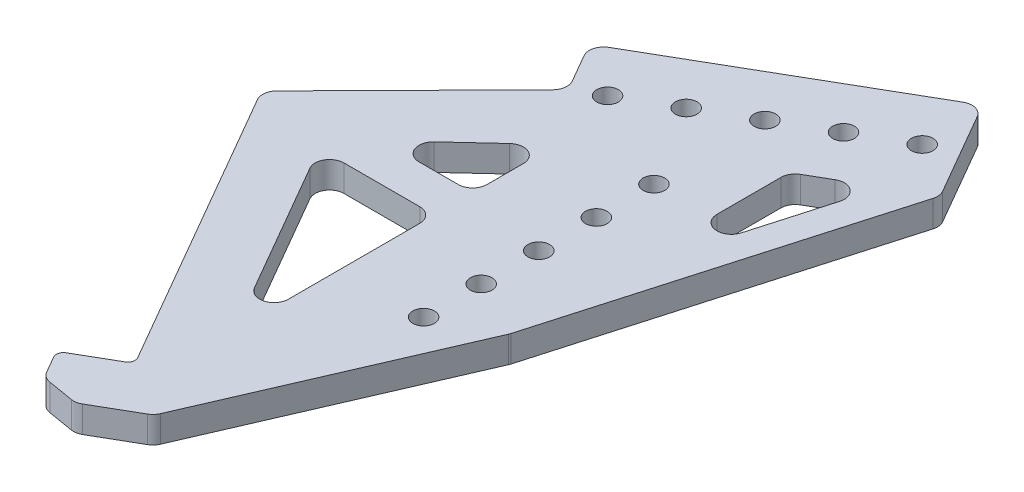
from build123d import *

# Parameters (mm, degrees)
SKETCH1_R           = 2.38125
BOSS_EXTRUDE1_DEPTH = 5.842
FILLET1_R           = 3.175
FILLET2_R           = 3.175
FILLET3_R           = 1.5875
FILLET5_R           = 3.175


with BuildPart() as part:
    # Sketch1 → Boss-Extrude1 (new body)
    with BuildSketch(Plane(origin=(0, 0, 0), x_dir=(1, 0, 0), z_dir=(0, 1, 0))):
        Polygon((-11.01238397, -123.675577549), (12.699883629, -68.919434524), (33.84630657, 4.876477372), (21.14630657, 26.873522628), (-33.84630657, -4.876477372), (-27.49630657, -15.875), (-61.093499563, -49.937045256), (-22.993499563, -115.928181024), (-33.992022192, -122.278181024), (-30.325847982, -128.628181024), (-22.010906598, -130.025577549), align=None)
        with Locations((21.997045256, 12.7)):
            Circle(SKETCH1_R, mode=Mode.SUBTRACT)
        with Locations((10.998522628, 6.35)):
            Circle(SKETCH1_R, mode=Mode.SUBTRACT)
        Circle(SKETCH1_R, mode=Mode.SUBTRACT)
        with Locations((-10.998522628, -6.35)):
            Circle(SKETCH1_R, mode=Mode.SUBTRACT)
        with Locations((-21.997045256, -12.7)):
            Circle(SKETCH1_R, mode=Mode.SUBTRACT)
        with Locations((0, -24.4695218)):
            Circle(SKETCH1_R, mode=Mode.SUBTRACT)
        with Locations((0, -37.1695218)):
            Circle(SKETCH1_R, mode=Mode.SUBTRACT)
        with Locations((0, -49.8695218)):
            Circle(SKETCH1_R, mode=Mode.SUBTRACT)
        with Locations((0, -62.5695218)):
            Circle(SKETCH1_R, mode=Mode.SUBTRACT)
        with Locations((0, -75.2695218)):
            Circle(SKETCH1_R, mode=Mode.SUBTRACT)
        Polygon((25.931282224, 0.306735935), (12.7, -7.332348419), (12.7, -16.277642723), (12.7, -45.867554067), align=None, mode=Mode.SUBTRACT)
        Polygon((-43.744976935, -54.585567884), (-18.344976935, -98.579658396), (-18.344976935, -54.585567884), align=None, mode=Mode.SUBTRACT)
        Polygon((-38.267154833, -46.106477151), (-18.344976935, -46.106477151), (-18.344976935, -27.655582651), align=None, mode=Mode.SUBTRACT)
    extrude(amount=BOSS_EXTRUDE1_DEPTH)

    # Fillet1
    fillet1_edges = [part.edges().sort_by_distance(p)[0] for p in [
        (-18.344976935, 2.921, 54.585567884),
        (-43.744976935, 2.921, 54.585567884),
        (-18.344976935, 2.921, 98.579658396),
        (25.931282224, 2.921, -0.306735935),
        (12.7, 2.921, 7.332348419),
        (12.7, 2.921, 45.867554067),
        (-18.344976935, 2.921, 27.655582651),
        (-18.344976935, 2.921, 46.106477151),
        (-38.267154833, 2.921, 46.106477151),
    ]]
    fillet(fillet1_edges, radius=FILLET1_R)

    # Fillet2
    fillet2_edges = [part.edges().sort_by_distance(p)[0] for p in [
        (33.84630657, 2.921, -4.876477372),
        (21.14630657, 2.921, -26.873522628),
        (-33.84630657, 2.921, 4.876477372),
        (-27.49630657, 2.921, 15.875),
        (-61.093499563, 2.921, 49.937045256),
    ]]
    fillet(fillet2_edges, radius=FILLET2_R)

    # Fillet3
    fillet3_edges = [part.edges().sort_by_distance(p)[0] for p in [
        (-33.992022192, 2.921, 122.278181024),
        (-22.993499563, 2.921, 115.928181024),
    ]]
    fillet(fillet3_edges, radius=FILLET3_R)

    # Fillet5
    fillet5_edges = [part.edges().sort_by_distance(p)[0] for p in [
        (-30.325847982, 2.921, 128.628181024),
        (-22.010906598, 2.921, 130.025577549),
        (12.699883629, 2.921, 68.919434524),
        (-11.01238397, 2.921, 123.675577549),
    ]]
    fillet(fillet5_edges, radius=FILLET5_R)


solid = part.part
